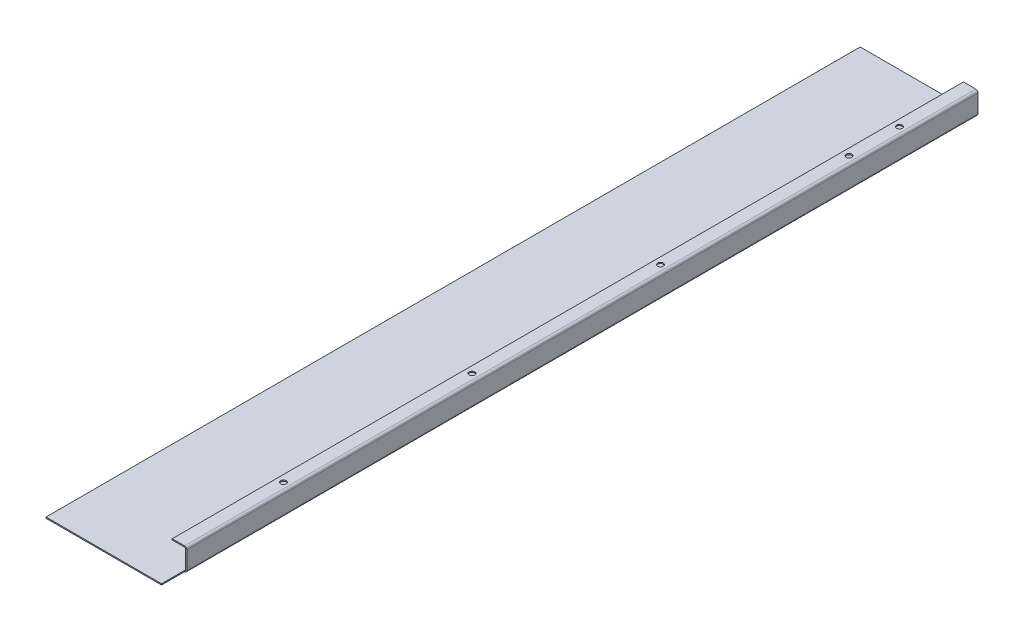
from build123d import *

# Parameters (mm, degrees)
SKETCH1_W                    = 105
SKETCH1_H                    = 725.7
BASE_FLANGE1_DEPTH           = 1
EDGE_FLANGE1_STRIP_W         = 6
EDGE_FLANGE1_STRIP_H         = 1
EDGE_FLANGE1_STRIP_CUT_DEPTH = 725.7
EDGE_FLANGE1_DEPTH           = 725.7
EDGE_FLANGE2_STRIP_W         = 6
EDGE_FLANGE2_STRIP_H         = 1
EDGE_FLANGE2_STRIP_CUT_DEPTH = 725.7
EDGE_FLANGE2_DEPTH           = 725.7
SKETCH19_R                   = 2.5
CUT_EXTRUDE2_DEPTH           = 10
CUT_EXTRUDE3_START           = -20.5
CUT_EXTRUDE3_DEPTH           = 20.5


# Read off the part's stored shape, not the designer's step: Cut-Extrude3
# Sheet-metal steps are written as plain solids
with BuildPart() as part:
    # Sketch1 → Base-Flange1 (new body)
    with BuildSketch(Plane(origin=(0, 0, 0), x_dir=(1, 0, 0), z_dir=(0, 1, 0))):
        with Locations((52.5, 362.85)):
            Rectangle(SKETCH1_W, SKETCH1_H)
    extrude(amount=-BASE_FLANGE1_DEPTH)

    # Edge-Flange1 strip (across the edge) → Edge-Flange1 strip cut (cut)
    with BuildSketch(Plane(origin=(105, 0, 0), x_dir=(-1, 0, 0), z_dir=(0, 0, -1))):
        with Locations((-1, -0.5)):
            Rectangle(EDGE_FLANGE1_STRIP_W, EDGE_FLANGE1_STRIP_H)
    extrude(amount=EDGE_FLANGE1_STRIP_CUT_DEPTH, mode=Mode.SUBTRACT)

    # Edge-Flange1 section (across the edge) → Edge-Flange1 (add)
    with BuildSketch(Plane(origin=(105, 0, 0), x_dir=(-1, 0, 0), z_dir=(0, 0, -1))):
        with BuildLine():
            Line((0, 1), (0, 19))
            Line((0, 19), (1, 19))
            Line((1, 19), (1, 1))
            ThreePointArc((1, 1), (1.292893219, 0.292893219), (2, 0))
            Line((2, 0), (2, -1))
            ThreePointArc((2, -1), (0.585786438, -0.414213562), (0, 1))
        make_face()
    extrude(amount=EDGE_FLANGE1_DEPTH)

    # Edge-Flange2 strip (across the edge) → Edge-Flange2 strip cut (cut)
    with BuildSketch(Plane(origin=(104, 19, 0), x_dir=(0, -1, 0), z_dir=(0, 0, -1))):
        with Locations((-1, -0.5)):
            Rectangle(EDGE_FLANGE2_STRIP_W, EDGE_FLANGE2_STRIP_H)
    extrude(amount=EDGE_FLANGE2_STRIP_CUT_DEPTH, mode=Mode.SUBTRACT)

    # Edge-Flange2 section (across the edge) → Edge-Flange2 (add)
    with BuildSketch(Plane(origin=(104, 19, 0), x_dir=(0, -1, 0), z_dir=(0, 0, -1))):
        with BuildLine():
            Line((0, 1), (0, 12))
            Line((0, 12), (1, 12))
            Line((1, 12), (1, 1))
            ThreePointArc((1, 1), (1.292893219, 0.292893219), (2, 0))
            Line((2, 0), (2, -1))
            ThreePointArc((2, -1), (0.585786438, -0.414213562), (0, 1))
        make_face()
    extrude(amount=EDGE_FLANGE2_DEPTH)

    # Sketch19 → Cut-Extrude2 (cut)
    with BuildSketch(Plane(origin=(0, 19, 0), x_dir=(1, 0, 0), z_dir=(0, 1, 0))):
        with Locations(Location((98, 662.7, 0), (0, 0, 180))):
            Circle(SKETCH19_R)
        with Locations(Location((98, 617.7, 0), (0, 0, 180))):
            Circle(SKETCH19_R)
        with Locations(Location((98, 449.7, 0), (0, 0, 180))):
            Circle(SKETCH19_R)
        with Locations(Location((98, 281.7, 0), (0, 0, 180))):
            Circle(SKETCH19_R)
        with Locations(Location((98, 113.7, 0), (0, 0, 180))):
            Circle(SKETCH19_R)
        with Locations((98, -54.3)):
            Circle(SKETCH19_R)
    extrude(amount=-CUT_EXTRUDE2_DEPTH, mode=Mode.SUBTRACT)

    # Cut-Extrude3 outline → Cut-Extrude3 (cut)
    with BuildSketch(Plane.XY.offset(CUT_EXTRUDE3_START)):
        with BuildLine():
            ThreePointArc((104, 1), (103.707106781, 0.292893219), (103, 0))
            Line((103, 0), (103, -1))
            ThreePointArc((103, -1), (104.414213562, -0.414213562), (105, 1))
            Line((105, 1), (105, 17))
            ThreePointArc((105, 17), (104.414213562, 18.414213562), (103, 19))
            Line((103, 19), (92, 19))
            Line((92, 19), (92, 18))
            Line((92, 18), (103, 18))
            ThreePointArc((103, 18), (103.707106781, 17.707106781), (104, 17))
            Line((104, 17), (104, 1))
        make_face()
    extrude(amount=CUT_EXTRUDE3_DEPTH, mode=Mode.SUBTRACT)


solid = part.part
